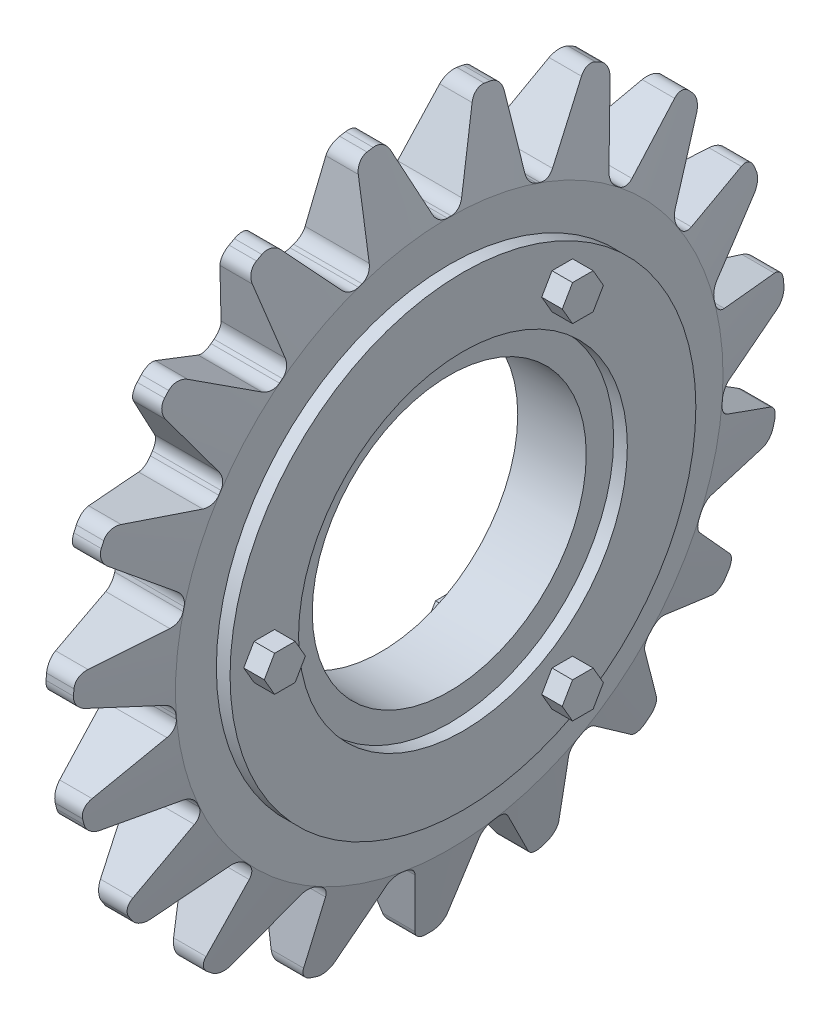
from build123d import *

# Parameters (mm, degrees)
SKETCH1_R                = 20
SKETCH1_R_2              = 17
SKETCH1_R_3              = 12
SKETCH1_R_4              = 10
BOSS_EXTRUDE1_DEPTH      = 2.5
BOSS_EXTRUDE2_DEPTH      = 5
FILLET1_R                = 1
FILLET2_R                = 1
CIRPATTERN1_COUNT        = 19
FILLET1_OF_CIRPATTERN1_R = 1
FILLET2_OF_CIRPATTERN1_R = 1
SKETCH1_3_R              = 17
SKETCH1_3_R_2            = 12
BOSS_EXTRUDE3_DEPTH      = 3.5
BOSS_EXTRUDE4_DEPTH      = 1.5
CIRPATTERN3_COUNT        = 3
MIRROR1_COPY_1_DEPTH     = 1.5
MIRROR1_COPY_2_DEPTH     = 1.5


with BuildPart() as part:
    # Sketch1 → Boss-Extrude1 (new, symmetric)
    # profile 1 of 3: a face of its own
    with BuildSketch(Plane.YZ):
        with Locations(Location((0, 0, 0), (0, 0, 270))):
            Circle(SKETCH1_R)
        Circle(SKETCH1_R_2, mode=Mode.SUBTRACT)
    # profile 2 of 3: a face of its own
    with BuildSketch(Plane.YZ):
        Circle(SKETCH1_R_2)
        Circle(SKETCH1_R_3, mode=Mode.SUBTRACT)
    # profile 3 of 3: a face of its own
    with BuildSketch(Plane.YZ):
        Circle(SKETCH1_R_3)
        with Locations(Location((0, 0, 0), (0, 0, 270))):
            Circle(SKETCH1_R_4, mode=Mode.SUBTRACT)
    extrude(amount=BOSS_EXTRUDE1_DEPTH, both=True)

    # Sketch2 → Boss-Extrude2 (add)
    with BuildSketch(Plane.YZ.offset(2.5)):
        with BuildLine():
            ThreePointArc((-25.98057957, 1.004731409), (-25.995144439, 0.50245954), (-26, 0))
            ThreePointArc((-26, 0), (-25.995144439, -0.50245954), (-25.98057957, -1.004731409))
            Line((-25.98057957, -1.004731409), (-19.843134833, -2.5))
            ThreePointArc((-19.843134833, -2.5), (-20, 0), (-19.843134833, 2.5))
            Line((-19.843134833, 2.5), (-25.98057957, 1.004731409))
        make_face()
    boss_extrude2 = extrude(amount=-BOSS_EXTRUDE2_DEPTH)

    # Fillet1
    fillet1_edges = [part.edges().sort_by_distance(p)[0] for p in [
        (0, -25.98057957, 1.004731409),
        (0, -25.98057957, -1.004731409),
    ]]
    fillet(fillet1_edges, radius=FILLET1_R)

    # Fillet2
    fillet2_edges = [part.edges().sort_by_distance(p)[0] for p in [
        (0, -19.843134833, 2.5),
        (0, -19.843134833, -2.5),
    ]]
    fillet(fillet2_edges, radius=FILLET2_R)

    # CirPattern1: Boss-Extrude2 ×19 about axis
    cirpattern1_axis = Axis((0, 0, 0), (1, 0, 0))
    for i in range(1, CIRPATTERN1_COUNT):
        add(boss_extrude2.rotate(cirpattern1_axis, i * 360 / CIRPATTERN1_COUNT))

    # Fillet1 of CirPattern1
    fillet1_of_cirpattern1_edges = [part.edges().sort_by_distance(p)[0] for p in [
        (0, -24.899115862, -7.485588106),
        (0, -24.246644352, -9.386172686),
        (0, -21.1194466, -15.164727999),
        (0, -19.885208992, -16.750476511),
        (0, -15.051157598, -21.200534309),
        (0, -13.368902688, -22.299606295),
        (0, -7.351842127, -24.938933765),
        (0, -5.403868337, -25.432227724),
        (0, 1.144159514, -25.974812781),
        (0, 3.146758997, -25.808872657),
        (0, 9.516173719, -24.195917791),
        (0, 11.356386168, -23.388725771),
        (0, 16.856962842, -19.79501967),
        (0, 18.335372684, -18.434047535),
        (0, 22.371038478, -13.249024017),
        (0, 23.327437068, -11.481754215),
        (0, 25.460864973, -5.267291031),
        (0, 25.791611682, -3.285234668),
        (0, 25.791611682, 3.285234668),
        (0, 25.460864973, 5.267291031),
        (0, 23.327437068, 11.481754215),
        (0, 22.371038478, 13.249024017),
        (0, 18.335372684, 18.434047535),
        (0, 16.856962842, 19.79501967),
        (0, 11.356386168, 23.388725771),
        (0, 9.516173719, 24.195917791),
        (0, 3.146758997, 25.808872657),
        (0, 1.144159514, 25.974812781),
        (0, -5.403868337, 25.432227724),
        (0, -7.351842127, 24.938933765),
        (0, -13.368902688, 22.299606295),
        (0, -15.051157598, 21.200534309),
        (0, -19.885208992, 16.750476511),
        (0, -21.1194466, 15.164727999),
        (0, -24.246644352, 9.386172686),
        (0, -24.899115862, 7.485588106),
    ]]
    fillet(fillet1_of_cirpattern1_edges, radius=FILLET1_OF_CIRPATTERN1_R)

    # Fillet2 of CirPattern1
    fillet2_of_cirpattern1_edges = [part.edges().sort_by_distance(p)[0] for p in [
        (0, -19.579727727, -4.078512243),
        (0, -17.956230381, -8.807598452),
        (0, -17.194553312, -10.215054401),
        (0, -14.123489748, -14.160756948),
        (0, -12.946082244, -15.244636911),
        (0, -8.760249853, -17.979377701),
        (0, -7.294702286, -18.622226466),
        (0, -2.447700956, -19.849653902),
        (0, -0.852828146, -19.981808831),
        (0, 4.130094319, -19.568912104),
        (0, 5.681463157, -19.176052159),
        (0, 10.26032979, -17.167575036),
        (0, 11.600079769, -16.292272688),
        (0, 15.278699322, -12.90586483),
        (0, 16.261647745, -11.642972671),
        (0, 18.64138471, -7.245603915),
        (0, 19.161013862, -5.731975906),
        (0, 19.983986813, -0.800169389),
        (0, 19.983986813, 0.800169389),
        (0, 19.161013862, 5.731975906),
        (0, 18.64138471, 7.245603915),
        (0, 16.261647745, 11.642972671),
        (0, 15.278699322, 12.90586483),
        (0, 11.600079769, 16.292272688),
        (0, 10.26032979, 17.167575036),
        (0, 5.681463157, 19.176052159),
        (0, 4.130094319, 19.568912104),
        (0, -0.852828146, 19.981808831),
        (0, -2.447700956, 19.849653902),
        (0, -7.294702286, 18.622226466),
        (0, -8.760249853, 17.979377701),
        (0, -12.946082244, 15.244636911),
        (0, -14.123489748, 14.160756948),
        (0, -17.194553312, 10.215054401),
        (0, -17.956230381, 8.807598452),
        (0, -19.579727727, 4.078512243),
    ]]
    fillet(fillet2_of_cirpattern1_edges, radius=FILLET2_OF_CIRPATTERN1_R)

    # Sketch3 → Cut-Revolve1 (revolve, cut)
    with BuildSketch(Plane(origin=(0, 0, 0), x_dir=(-1, 0, 0), z_dir=(0, 0, 1)), mode=Mode.PRIVATE) as cut_revolve1_sk:
        Polygon((1, 26), (2.5, 26), (2.5, 19.9838286), align=None)
        Polygon((-2.5, 19.9838286), (-1, 26), (-2.5, 26), align=None)
    revolve(cut_revolve1_sk.sketch.rotate(Axis((14.362974642, 0, 0), (-1, 0, 0)), 88.225572874), axis=Axis((14.362974642, 0, 0), (-1, 0, 0)), mode=Mode.SUBTRACT)

    # Sketch1<3> → Boss-Extrude3 (add, symmetric)
    with BuildSketch(Plane.YZ):
        with Locations(Location((0, 0, 0), (0, 0, 270))):
            Circle(SKETCH1_3_R)
        with Locations(Location((0, 0, 0), (0, 0, 270))):
            Circle(SKETCH1_3_R_2, mode=Mode.SUBTRACT)
    extrude(amount=BOSS_EXTRUDE3_DEPTH, both=True)

    # Sketch6 → Boss-Extrude4 (add)
    with BuildSketch(Plane(origin=(-3.5, 0, 0), x_dir=(0, -1, 0), z_dir=(-1, 0, 0))):
        Polygon((0, 12.9988893), (1.3, 13.74944465), (1.3, 15.25055535), (0, 16.0011107), (-1.3, 15.25055535), (-1.3, 13.74944465), align=None)
    boss_extrude4 = extrude(amount=BOSS_EXTRUDE4_DEPTH)

    # CirPattern3: Boss-Extrude4 ×3 about axis
    cirpattern3_axis = Axis((0, 0, 0), (1, 0, 0))
    for i in range(1, CIRPATTERN3_COUNT):
        add(boss_extrude4.rotate(cirpattern3_axis, i * 360 / CIRPATTERN3_COUNT))

    # Mirror1: Boss-Extrude4 across plane
    add(boss_extrude4.mirror(Plane(origin=(0, 0, 0), x_dir=(0, 0, 1), z_dir=(1, 0, 0))))

    # Mirror1 copy 1 sketch → Mirror1 copy 1 (add)
    with BuildSketch(Plane(origin=(3.5, 0, 0), x_dir=(0, 0.4999999999999998, -0.8660254037844387), z_dir=(1, 0, 0))):
        Polygon((0, -12.9988893), (1.3, -13.74944465), (1.3, -15.25055535), (0, -16.0011107), (-1.3, -15.25055535), (-1.3, -13.74944465), align=None)
    extrude(amount=MIRROR1_COPY_1_DEPTH)

    # Mirror1 copy 2 sketch → Mirror1 copy 2 (add)
    with BuildSketch(Plane(origin=(3.5, 0, 0), x_dir=(0, 0.5000000000000004, 0.8660254037844384), z_dir=(1, 0, 0))):
        Polygon((0, -12.9988893), (1.3, -13.74944465), (1.3, -15.25055535), (0, -16.0011107), (-1.3, -15.25055535), (-1.3, -13.74944465), align=None)
    extrude(amount=MIRROR1_COPY_2_DEPTH)


solid = part.part
